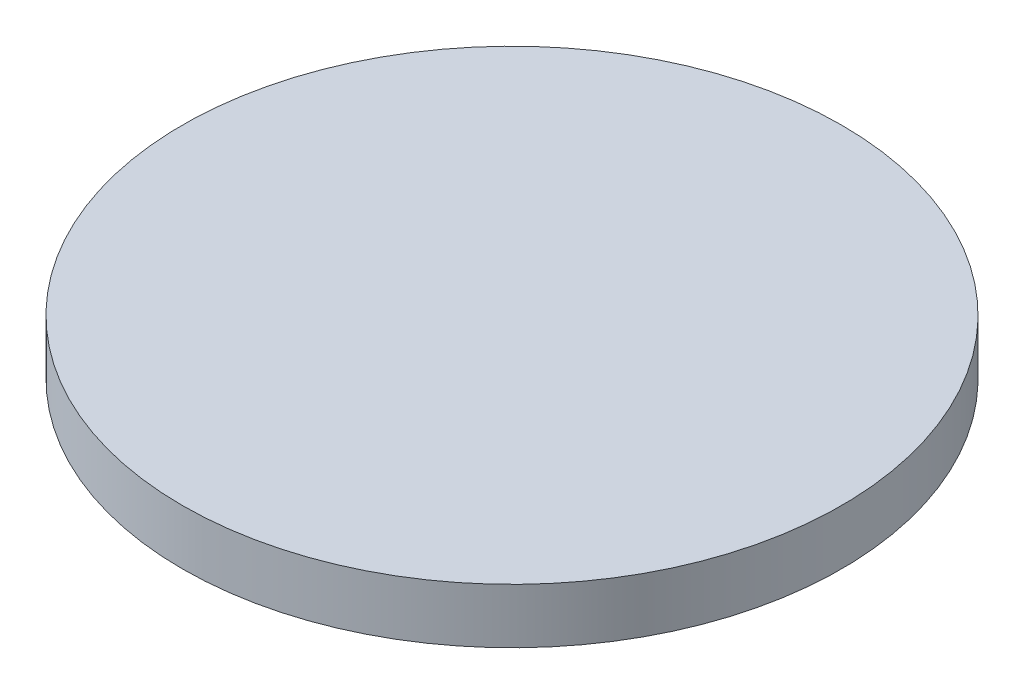
from build123d import *

# Parameters (mm, degrees)
SKETCH1_R           = 38.1
BOSS_EXTRUDE1_DEPTH = 6.35


with BuildPart() as part:
    # Sketch1 → Boss-Extrude1 (new body)
    with BuildSketch(Plane(origin=(0, 0, 0), x_dir=(1, 0, 0), z_dir=(0, 1, 0))):
        with Locations((-40.714400695, 6.565469357)):
            Circle(SKETCH1_R)
    extrude(amount=BOSS_EXTRUDE1_DEPTH)


solid = part.part
